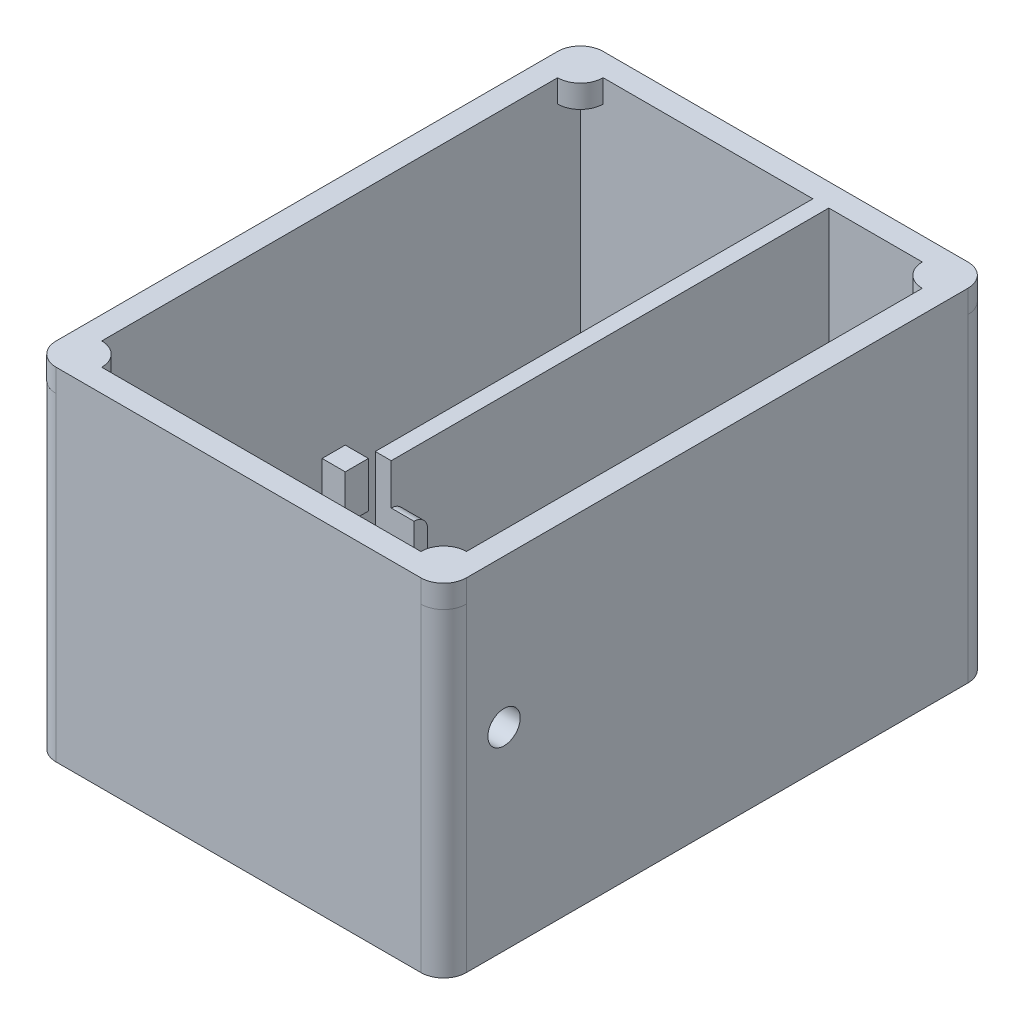
from build123d import *

# Parameters (mm, degrees)
SKETCH1_W                = 90.002256596
SKETCH1_H                = 119.999519638
BOSS_EXTRUDE1_DEPTH      = 70
SKETCH6_W                = 32
SKETCH6_H                = 11.5
CUT_EXTRUDE2_DEPTH       = 65.5
CUT_EXTRUDE11_DEPTH      = 126.400011923
CUT_EXTRUDE11_DEPTH_BACK = 126.400011923
SKETCH22_R               = 3.55
SKETCH2_W                = 25.5
SKETCH2_H                = 93
CUT_EXTRUDE12_DEPTH      = 65.5
SKETCH23_W               = 15.5
SKETCH23_H               = 55.5
CUT_EXTRUDE13_DEPTH      = 3
SKETCH24_W               = 14.034874412
SKETCH24_H               = 3
CUT_EXTRUDE14_DEPTH      = 3
FILLET2_R                = 5
FILLET3_R                = 5
FILLET4_R                = 5
FILLET5_R                = 5
SKETCH37_W               = 51.004117284
SKETCH37_H               = 107.502744057
CUT_EXTRUDE15_DEPTH      = 65.5
SKETCH53_W               = 3.5
SKETCH53_H               = 96
BOSS_EXTRUDE7_DEPTH      = 5
SKETCH54_W               = 25.5
SKETCH54_H               = 3
CUT_EXTRUDE16_DEPTH      = 4
CUT_EXTRUDE17_DEPTH      = 5
CUT_EXTRUDE18_START      = -5
CUT_EXTRUDE18_DEPTH      = 5
SKETCH58_W               = 80.004117284
SKETCH58_H               = 2.5
CUT_EXTRUDE19_DEPTH      = 65.5
BOSS_EXTRUDE8_START      = 14
SKETCH60_W               = 5.08
SKETCH60_H               = 5.08
BOSS_EXTRUDE8_DEPTH      = 10
BOSS_EXTRUDE9_DEPTH      = 5
SKETCH63_R               = 4.997016655
SKETCH63_R_2             = 4.999759946
SKETCH63_R_3             = 4.999760712
BOSS_EXTRUDE11_DEPTH     = 5
BOSS_EXTRUDE12_DEPTH     = 5


# Read off the part's stored shape, not the designer's step: Boss-Extrude12
with BuildPart() as part:
    # Sketch1 → Boss-Extrude1 (new body)
    with BuildSketch(Plane(origin=(0, 0, 0), x_dir=(1, 0, 0), z_dir=(0, 1, 0))):
        Rectangle(SKETCH1_W, SKETCH1_H)
    extrude(amount=BOSS_EXTRUDE1_DEPTH)

    # Sketch6 → Cut-Extrude2 (cut)
    with BuildSketch(Plane(origin=(0, 70, 0), x_dir=(1, 0, 0), z_dir=(0, 1, 0))):
        with Locations((24, -46.75)):
            Rectangle(SKETCH6_W, SKETCH6_H)
    extrude(amount=-CUT_EXTRUDE2_DEPTH, mode=Mode.SUBTRACT)

    # Sketch22 → Cut-Extrude11 (cut, two sides: drawn at the far end of the back side and taken through both)
    with BuildSketch(Plane.ZY.offset(-40).offset(-CUT_EXTRUDE11_DEPTH_BACK)):
        with Locations((46.75, 42.5)):
            Circle(SKETCH22_R)
    extrude(amount=CUT_EXTRUDE11_DEPTH + CUT_EXTRUDE11_DEPTH_BACK, mode=Mode.SUBTRACT)

    # Sketch2 → Cut-Extrude12 (cut)
    with BuildSketch(Plane(origin=(0, 70, 0), x_dir=(1, 0, 0), z_dir=(0, 1, 0))):
        with Locations((27.25, 8.5)):
            Rectangle(SKETCH2_W, SKETCH2_H)
    extrude(amount=-CUT_EXTRUDE12_DEPTH, mode=Mode.SUBTRACT)

    # Sketch23 → Cut-Extrude13 (cut)
    with BuildSketch(Plane(origin=(0, 0, 38), x_dir=(-1, 0, 0), z_dir=(0, 0, -1))):
        with Locations((-27.25, 38.25)):
            Rectangle(SKETCH23_W, SKETCH23_H)
    extrude(amount=-CUT_EXTRUDE13_DEPTH, mode=Mode.SUBTRACT)

    # Sketch24 → Cut-Extrude14 (cut)
    with BuildSketch(Plane(origin=(0, 0, 38), x_dir=(-1, 0, 0), z_dir=(0, 0, -1))):
        with Locations((-14.5, 19.5)):
            Rectangle(SKETCH24_W, SKETCH24_H)
    extrude(amount=-CUT_EXTRUDE14_DEPTH, mode=Mode.SUBTRACT)

    # Fillet2
    fillet2_edges = [part.edges().sort_by_distance(p)[0] for p in [
        (-45.001128298, 35, 59.999759819),
    ]]
    fillet(fillet2_edges, radius=FILLET2_R)

    # Fillet3
    fillet3_edges = [part.edges().sort_by_distance(p)[0] for p in [
        (45.001128298, 35, 59.999759819),
    ]]
    fillet(fillet3_edges, radius=FILLET3_R)

    # Fillet4
    fillet4_edges = [part.edges().sort_by_distance(p)[0] for p in [
        (45.001128298, 35, -59.999759819),
    ]]
    fillet(fillet4_edges, radius=FILLET4_R)

    # Fillet5
    fillet5_edges = [part.edges().sort_by_distance(p)[0] for p in [
        (-45.001128298, 35, -59.999759819),
    ]]
    fillet(fillet5_edges, radius=FILLET5_R)

    # Sketch37 → Cut-Extrude15 (cut)
    with BuildSketch(Plane(origin=(0, 70, 0), x_dir=(1, 0, 0), z_dir=(0, 1, 0))):
        with Locations((-14.502058642, 1.251372029)):
            Rectangle(SKETCH37_W, SKETCH37_H)
    extrude(amount=-CUT_EXTRUDE15_DEPTH, mode=Mode.SUBTRACT)

    # Sketch53 → Boss-Extrude7 (add)
    with BuildSketch(Plane(origin=(0, 70, 0), x_dir=(1, 0, 0), z_dir=(0, 1, 0))):
        with Locations((12.75, 7)):
            Rectangle(SKETCH53_W, SKETCH53_H)
    extrude(amount=BOSS_EXTRUDE7_DEPTH)

    # Sketch54 → Cut-Extrude16 (cut)
    with BuildSketch(Plane(origin=(0, 70, 0), x_dir=(1, 0, 0), z_dir=(0, 1, 0))):
        with Locations((27.25, -39.5)):
            Rectangle(SKETCH54_W, SKETCH54_H)
    extrude(amount=-CUT_EXTRUDE16_DEPTH, mode=Mode.SUBTRACT)

    # Sketch55 → Cut-Extrude17 (cut)
    with BuildSketch(Plane(origin=(19.5, 0, 0), x_dir=(0, 0, -1), z_dir=(1, 0, 0))):
        with BuildLine():
            Line((-38, 66), (-41, 66))
            ThreePointArc((-41, 66), (-38.878679656, 65.121320344), (-38, 63))
            Line((-38, 63), (-38, 66))
        make_face()
    extrude(amount=-CUT_EXTRUDE17_DEPTH, mode=Mode.SUBTRACT)

    # Sketch56 → Cut-Extrude18 (cut)
    with BuildSketch(Plane.ZY.offset(-35).offset(CUT_EXTRUDE18_START)):
        with BuildLine():
            Line((38, 66), (41, 66))
            ThreePointArc((41, 66), (38.878679656, 65.121320344), (38, 63))
            Line((38, 63), (38, 66))
        make_face()
    extrude(amount=CUT_EXTRUDE18_DEPTH, mode=Mode.SUBTRACT)

    # Sketch58 → Cut-Extrude19 (cut)
    with BuildSketch(Plane(origin=(0, 70, 0), x_dir=(1, 0, 0), z_dir=(0, 1, 0))):
        with Locations((-0.002058642, -53.75)):
            Rectangle(SKETCH58_W, SKETCH58_H)
    extrude(amount=-CUT_EXTRUDE19_DEPTH, mode=Mode.SUBTRACT)

    # Sketch60 → Boss-Extrude8 (add)
    with BuildSketch(Plane(origin=(0, 4.5, 0), x_dir=(1, 0, 0), z_dir=(0, 1, 0)).offset(BOSS_EXTRUDE8_START)):
        with Locations((8.46, -52.46)):
            Rectangle(SKETCH60_W, SKETCH60_H)
        with Locations((-37.464117284, -52.46)):
            Rectangle(SKETCH60_W, SKETCH60_H)
        with Locations((-37.464117284, 0.88)):
            Rectangle(SKETCH60_W, SKETCH60_H)
        with Locations((8.46, 0.88)):
            Rectangle(SKETCH60_W, SKETCH60_H)
    extrude(amount=BOSS_EXTRUDE8_DEPTH)

    # Sketch61 → Boss-Extrude9 (add)
    with BuildSketch(Plane(origin=(0, 70, 0), x_dir=(1, 0, 0), z_dir=(0, 1, 0))):
        Polygon((40, 54.999759819), (40, -55), (45.001128298, -55), (45.001128298, -54.999759819), (45.001128298, 54.999759819), align=None)
        Polygon((-40.004117284, -54.999759819), (-40.004117284, 55), (-45.001128298, 55), (-45.001128298, 54.999759819), (-45.001128298, -54.999759819), align=None)
    extrude(amount=BOSS_EXTRUDE9_DEPTH)

    # Sketch63 → Boss-Extrude11 (add)
    with BuildSketch(Plane(origin=(0, 70, 0), x_dir=(1, 0, 0), z_dir=(0, 1, 0))):
        with Locations((-40.004117284, 55.002744057)):
            Circle(SKETCH63_R)
        with Locations((40, 55)):
            Circle(SKETCH63_R_2)
        with Locations((40, -55)):
            Circle(SKETCH63_R_2)
        with Locations((-40.004117284, -55)):
            Circle(SKETCH63_R_3)
    extrude(amount=BOSS_EXTRUDE11_DEPTH)

    # Boss-Extrude12 outline → Boss-Extrude12 (add)
    with BuildSketch(Plane(origin=(0, 70, 0), x_dir=(1, 0, 0), z_dir=(0, 1, 0))):
        with BuildLine():
            Line((11, 55.002744057), (11, 55))
            Line((11, 55), (35.000240054, 55))
            ThreePointArc((35.000240054, 55), (36.464635838, 58.535364162), (40, 59.999759946))
            Line((40, 59.999759946), (-40.001128298, 59.999759819))
            ThreePointArc((-40.001128298, 59.999759819), (-36.469636313, 58.535111496), (-35.007100628, 55.002744057))
            Line((-35.007100628, 55.002744057), (11, 55.002744057))
        make_face()
        with BuildLine():
            Line((-40.001128298, -59.999759819), (40, -59.999759946))
            ThreePointArc((40, -59.999759946), (36.464635838, -58.535364162), (35.000240054, -55))
            Line((35.000240054, -55), (-35.004356572, -55))
            ThreePointArc((-35.004356572, -55), (-36.467695972, -58.53430778), (-40.001128298, -59.999759819))
        make_face()
    extrude(amount=BOSS_EXTRUDE12_DEPTH)


solid = part.part
